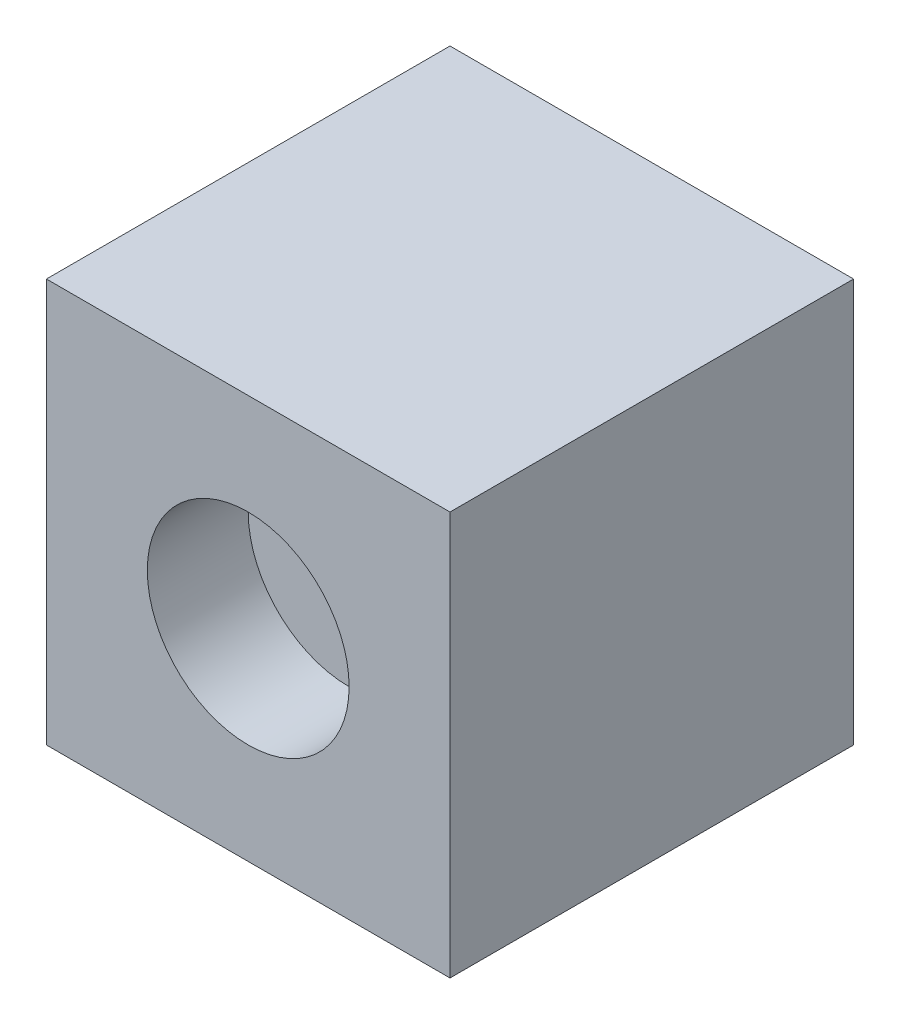
from build123d import *

# Parameters (mm, degrees)
SKETCH1_W           = 20
SKETCH1_H           = 20
BOSS_EXTRUDE1_DEPTH = 20
SKETCH2_R           = 5
CUT_EXTRUDE1_DEPTH  = 5


with BuildPart() as part:
    # Sketch1 → Boss-Extrude1 (new body)
    with BuildSketch(Plane.XY):
        Rectangle(SKETCH1_W, SKETCH1_H)
    extrude(amount=BOSS_EXTRUDE1_DEPTH)

    # Sketch2 → Cut-Extrude1 (cut)
    with BuildSketch(Plane.XY.offset(20)):
        Circle(SKETCH2_R)
    extrude(amount=-CUT_EXTRUDE1_DEPTH, mode=Mode.SUBTRACT)


solid = part.part
